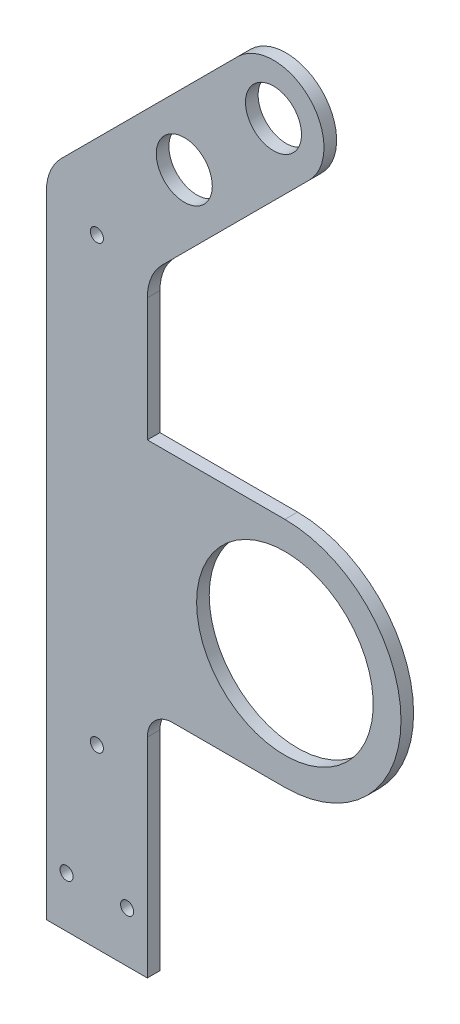
from build123d import *

# Parameters (mm, degrees)
SKETCH_1_R                = 20
SKETCH_1_R_2              = 11.1
EXTRUDE_1_DEPTH           = 60
EXTRUDE_2_DEPTH           = 30
SKETCH_4_R                = 11
EXTRUDE_3_DEPTH           = 5
SKETCH_8_R                = 11.1
CUT_EXTRUDE_1_DEPTH       = 100
FILLET_4_R                = 20
EXTRUDE_START             = -30
SKETCH_18_R               = 35
EXTRUDE_4_DEPTH           = 5
EXTRUDE_START_2           = -25
SKETCH_19_R               = 35
EXTRUDE_5_DEPTH           = 5
FILLET_5_R                = 10
CUT_EXTRUDE_9_DEPTH       = 388.169213652
CUT_EXTRUDE_9_DEPTH_BACK  = 388.169213652
SKETCH_21_R               = 2.6
CUT_EXTRUDE_10_DEPTH      = 409.372938359
CUT_EXTRUDE_10_DEPTH_BACK = 409.372938359
SKETCH_22_W               = 30
SKETCH_22_H               = 469.737304999
SKETCH_22_W_2             = 35
SKETCH_22_H_2             = 431.087956996


with BuildPart() as part:
    # 草图1 → 凸台-拉伸1 (new body)
    with BuildSketch(Plane.XY):
        Circle(SKETCH_1_R)
        Circle(SKETCH_1_R_2, mode=Mode.SUBTRACT)
    extrude(amount=EXTRUDE_1_DEPTH)

    # 草图2 → 凸台-拉伸2 (add, symmetric)
    with BuildSketch(Plane.XY.offset(30)):
        with BuildLine():
            Line((-14.142135624, 14.142135624), (-90, -61.715728753))
            Line((-90, -61.715728753), (-90, -320))
            Line((-90, -320), (-50, -320))
            Line((-50, -320), (-50, -78.284271247))
            Line((-50, -78.284271247), (14.142135624, -14.142135624))
            ThreePointArc((14.142135624, -14.142135624), (-14.142135624, -14.142135624), (-14.142135624, 14.142135624))
        make_face()
    extrude(amount=EXTRUDE_2_DEPTH, both=True)

    # 草图4 → 凸台-拉伸3 (add)
    with BuildSketch(Plane.XY.offset(60)):
        with BuildLine():
            Line((-90, -290), (-50, -290))
            Line((-50, -290), (-50, -350))
            ThreePointArc((-50, -350), (-70, -370), (-90, -350))
            Line((-90, -350), (-90, -290))
        make_face()
        with Locations((-70, -350)):
            Circle(SKETCH_4_R, mode=Mode.SUBTRACT)
    extrude_3 = extrude(amount=EXTRUDE_3_DEPTH)

    # 镜向1: 凸台-拉伸3 across plane
    add(extrude_3.mirror(Plane.XY.offset(30)))

    # 草图8 → 切除-拉伸1 (cut)
    with BuildSketch(Plane.XY.offset(60)):
        with Locations((-35.355339059, -35.355339059)):
            Circle(SKETCH_8_R)
    extrude(amount=-CUT_EXTRUDE_1_DEPTH, mode=Mode.SUBTRACT)

    # 圆角4
    fillet_4_edges = [part.edges().sort_by_distance(p)[0] for p in [
        (-50, -78.284271247, 30),
        (-90, -61.715728753, 30),
    ]]
    fillet(fillet_4_edges, radius=FILLET_4_R)

    # 草图18 → 凸台-拉伸4 (add)
    with BuildSketch(Plane.XY.offset(60).offset(EXTRUDE_START)):
        with BuildLine():
            ThreePointArc((16.783988507, -10.876475983), (15.54903282, -12.578854413), (14.142135624, -14.142135624))
            Line((14.142135624, -14.142135624), (-44.142135624, -72.426406871))
            ThreePointArc((-44.142135624, -72.426406871), (-48.47759065, -78.914873848), (-50, -86.568542495))
            Line((-50, -86.568542495), (-50, -129.282056212))
            Line((-50, -129.282056212), (24.135744866, -129.282056212))
            ThreePointArc((24.135744866, -129.282056212), (66.634203362, -100.885494101), (56.662656801, -50.755144277))
            Line((56.662656801, -50.755144277), (16.783988507, -10.876475983))
        make_face()
        with Locations((24.135744866, -83.282056212)):
            Circle(SKETCH_18_R, mode=Mode.SUBTRACT)
    extrude(amount=EXTRUDE_4_DEPTH)

    # 草图19 → 凸台-拉伸5 (add)
    with BuildSketch(Plane(origin=(0, 0, 0), x_dir=(-1, 0, 0), z_dir=(0, 0, -1)).offset(EXTRUDE_START_2)):
        with BuildLine():
            Line((50, -135.340123781), (50, -227.340123781))
            Line((50, -227.340123781), (-4.524131353, -227.340123781))
            ThreePointArc((-4.524131353, -227.340123781), (-50.524131353, -181.340123781), (-4.524131353, -135.340123781))
            Line((-4.524131353, -135.340123781), (50, -135.340123781))
        make_face()
        with Locations((-4.524131353, -181.340123781)):
            Circle(SKETCH_19_R, mode=Mode.SUBTRACT)
    extrude(amount=-EXTRUDE_5_DEPTH)

    # 圆角5
    # the kernel refuses this fillet: 10 mm, written as the material it adds along each edge
    with BuildSketch(Plane(origin=(-50, -227.340123781, 25), x_dir=(0, -1, 0), z_dir=(0, 0, 1)), Plane(origin=(-50, -129.282056212, 30), x_dir=(0, -1, 0), z_dir=(0, 0, 1))) as fillet_5_piece_1:
        with BuildLine():
            CenterArc((FILLET_5_R, FILLET_5_R), FILLET_5_R, 180, 90)
            Line((0, FILLET_5_R), (0, 0))
            Line((0, 0), (FILLET_5_R, 0))
        make_face()
    extrude(amount=5)

    # 草图21 → 切除-拉伸9 (cut, two sides: drawn at the far end of the back side and taken through both)
    with BuildSketch(Plane.XY.offset(65).offset(-CUT_EXTRUDE_9_DEPTH_BACK)):
        with Locations((-70, -75)):
            Circle(SKETCH_21_R)
        with Locations((-70, -250)):
            Circle(SKETCH_21_R)
        with Locations((-58, -300)):
            Circle(SKETCH_21_R)
        with Locations((-82, -300)):
            Circle(SKETCH_21_R)
    extrude(amount=CUT_EXTRUDE_9_DEPTH + CUT_EXTRUDE_9_DEPTH_BACK, mode=Mode.SUBTRACT)

    # 草图22 → 切除-拉伸10 (cut, two sides: drawn at the far end of the back side and taken through both)
    with BuildSketch(Plane.ZY.offset(90).offset(-CUT_EXTRUDE_10_DEPTH_BACK)):
        with Locations((10, -169.950732915)):
            Rectangle(SKETCH_22_W, SKETCH_22_H)
        with Locations((47.5, -154.456021502)):
            Rectangle(SKETCH_22_W_2, SKETCH_22_H_2)
    extrude(amount=CUT_EXTRUDE_10_DEPTH + CUT_EXTRUDE_10_DEPTH_BACK, mode=Mode.SUBTRACT)


solid = part.part
